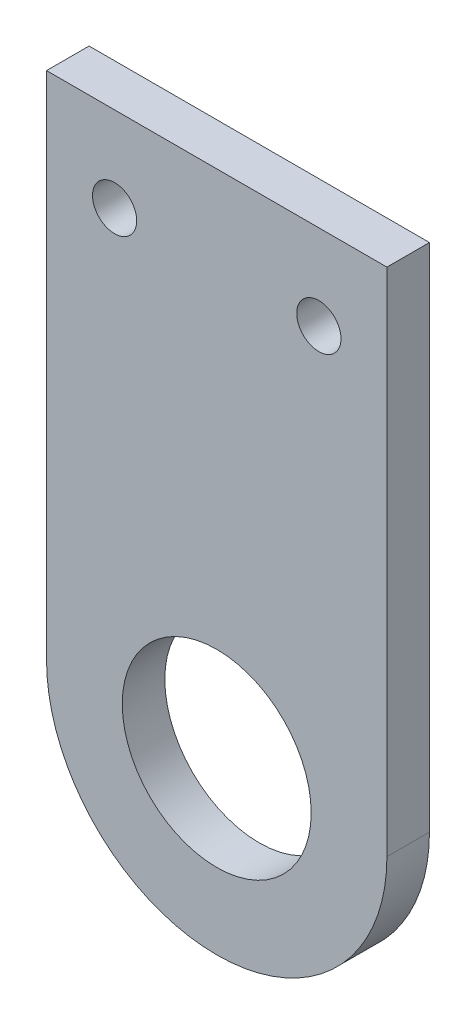
from build123d import *

# Parameters (mm, degrees)
SKETCH_1_R                = 20
SKETCH_1_R_2              = 11
EXTRUDE_1_DEPTH           = 60
EXTRUDE_2_DEPTH           = 30
SKETCH_4_R                = 11
EXTRUDE_3_DEPTH           = 5
SKETCH_8_R                = 11
CUT_EXTRUDE_1_DEPTH       = 100
FILLET_4_R                = 20
EXTRUDE_START             = -30
SKETCH_18_R               = 35
EXTRUDE_4_DEPTH           = 5
EXTRUDE_START_2           = -25
SKETCH_19_R               = 35
EXTRUDE_5_DEPTH           = 5
FILLET_5_R                = 10
CUT_EXTRUDE_9_DEPTH       = 388.169213652
CUT_EXTRUDE_9_DEPTH_BACK  = 388.169213652
SKETCH_21_R               = 2.6
CUT_EXTRUDE_10_DEPTH      = 407.881000043
CUT_EXTRUDE_10_DEPTH_BACK = 407.881000043
SKETCH_22_W               = 65
SKETCH_22_H               = 431.087956996
MOVE_FACE_1_BY            = 0.1


with BuildPart() as part:
    # 草图1 → 凸台-拉伸1 (new body)
    with BuildSketch(Plane.XY):
        Circle(SKETCH_1_R)
        Circle(SKETCH_1_R_2, mode=Mode.SUBTRACT)
    extrude(amount=EXTRUDE_1_DEPTH)

    # 草图2 → 凸台-拉伸2 (add, symmetric)
    with BuildSketch(Plane.XY.offset(30)):
        with BuildLine():
            Line((-14.142135624, 14.142135624), (-90, -61.715728753))
            Line((-90, -61.715728753), (-90, -320))
            Line((-90, -320), (-50, -320))
            Line((-50, -320), (-50, -78.284271247))
            Line((-50, -78.284271247), (14.142135624, -14.142135624))
            ThreePointArc((14.142135624, -14.142135624), (-14.142135624, -14.142135624), (-14.142135624, 14.142135624))
        make_face()
    extrude(amount=EXTRUDE_2_DEPTH, both=True)

    # 草图4 → 凸台-拉伸3 (add)
    with BuildSketch(Plane.XY.offset(60)):
        with BuildLine():
            Line((-90, -290), (-50, -290))
            Line((-50, -290), (-50, -350))
            ThreePointArc((-50, -350), (-70, -370), (-90, -350))
            Line((-90, -350), (-90, -290))
        make_face()
        with Locations((-70, -350)):
            Circle(SKETCH_4_R, mode=Mode.SUBTRACT)
    extrude_3 = extrude(amount=EXTRUDE_3_DEPTH)

    # 镜向1: 凸台-拉伸3 across plane
    add(extrude_3.mirror(Plane.XY.offset(30)))

    # 草图8 → 切除-拉伸1 (cut)
    with BuildSketch(Plane.XY.offset(60)):
        with Locations((-35.355339059, -35.355339059)):
            Circle(SKETCH_8_R)
    extrude(amount=-CUT_EXTRUDE_1_DEPTH, mode=Mode.SUBTRACT)

    # 圆角4
    fillet_4_edges = [part.edges().sort_by_distance(p)[0] for p in [
        (-50, -78.284271247, 30),
        (-90, -61.715728753, 30),
    ]]
    fillet(fillet_4_edges, radius=FILLET_4_R)

    # 草图18 → 凸台-拉伸4 (add)
    with BuildSketch(Plane.XY.offset(60).offset(EXTRUDE_START)):
        with BuildLine():
            ThreePointArc((15.487252676, -12.654841151), (14.833346688, -13.415357842), (14.142135624, -14.142135624))
            Line((14.142135624, -14.142135624), (-44.142135624, -72.426406871))
            ThreePointArc((-44.142135624, -72.426406871), (-48.47759065, -78.914873848), (-50, -86.568542495))
            Line((-50, -86.568542495), (-50, -128.513280962))
            Line((-50, -128.513280962), (20.291868618, -128.513280962))
            ThreePointArc((20.291868618, -128.513280962), (62.790327113, -100.116718851), (52.818780552, -49.986369028))
            Line((52.818780552, -49.986369028), (15.487252676, -12.654841151))
        make_face()
        with Locations((20.291868618, -82.513280962)):
            Circle(SKETCH_18_R, mode=Mode.SUBTRACT)
    extrude(amount=EXTRUDE_4_DEPTH)

    # 草图19 → 凸台-拉伸5 (add)
    with BuildSketch(Plane(origin=(0, 0, 0), x_dir=(-1, 0, 0), z_dir=(0, 0, -1)).offset(EXTRUDE_START_2)):
        with BuildLine():
            Line((50, -134.571348531), (50, -226.571348531))
            Line((50, -226.571348531), (-0.680255104, -226.571348531))
            ThreePointArc((-0.680255104, -226.571348531), (-46.680255104, -180.571348531), (-0.680255104, -134.571348531))
            Line((-0.680255104, -134.571348531), (50, -134.571348531))
        make_face()
        with Locations((-0.680255104, -180.571348531)):
            Circle(SKETCH_19_R, mode=Mode.SUBTRACT)
    extrude(amount=-EXTRUDE_5_DEPTH)

    # 圆角5
    # the kernel refuses this fillet: 10 mm, written as the material it adds along each edge
    with BuildSketch(Plane(origin=(-50, -226.571348531, 25), x_dir=(0, -1, 0), z_dir=(0, 0, 1)), Plane(origin=(-50, -128.513280962, 30), x_dir=(0, -1, 0), z_dir=(0, 0, 1))) as fillet_5_piece_1:
        with BuildLine():
            CenterArc((FILLET_5_R, FILLET_5_R), FILLET_5_R, 180, 90)
            Line((0, FILLET_5_R), (0, 0))
            Line((0, 0), (FILLET_5_R, 0))
        make_face()
    extrude(amount=5)

    # 草图21 → 切除-拉伸9 (cut, two sides: drawn at the far end of the back side and taken through both)
    with BuildSketch(Plane.XY.offset(65).offset(-CUT_EXTRUDE_9_DEPTH_BACK)):
        with Locations((-70, -75)):
            Circle(SKETCH_21_R)
        with Locations((-70, -250)):
            Circle(SKETCH_21_R)
        with Locations((-58, -300)):
            Circle(SKETCH_21_R)
        with Locations((-82, -300)):
            Circle(SKETCH_21_R)
    extrude(amount=CUT_EXTRUDE_9_DEPTH + CUT_EXTRUDE_9_DEPTH_BACK, mode=Mode.SUBTRACT)

    # 草图22 → 切除-拉伸10 (cut, two sides: drawn at the far end of the back side and taken through both)
    with BuildSketch(Plane.ZY.offset(90).offset(-CUT_EXTRUDE_10_DEPTH_BACK)):
        with Locations((32.5, -154.456021502)):
            Rectangle(SKETCH_22_W, SKETCH_22_H)
    extrude(amount=CUT_EXTRUDE_10_DEPTH + CUT_EXTRUDE_10_DEPTH_BACK, mode=Mode.SUBTRACT)

    # Move Face 1: a curved face moved inward by 0.1
    add(Solid.thicken(part.faces().sort_by_distance((-81, -350, -2.5))[0], -MOVE_FACE_1_BY), mode=Mode.SUBTRACT)


solid = part.part
